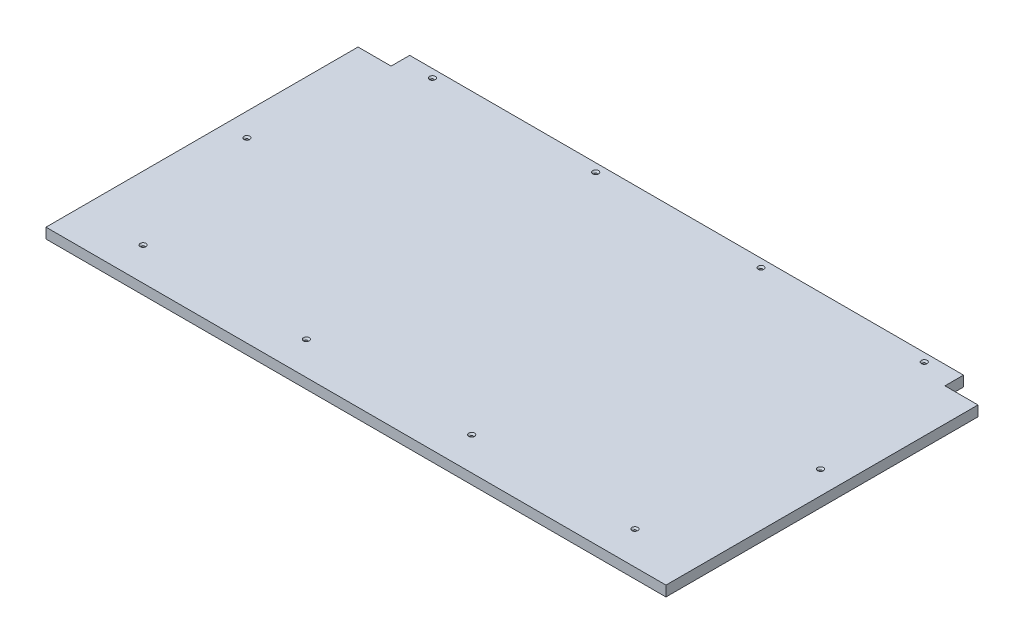
from build123d import *

# Parameters (mm, degrees)
SKETCH1_W                                 = 1500
SKETCH1_H                                 = 800
RAWMATERIAL_DEPTH                         = 25
SKETCH2_W                                 = 80
SKETCH2_H                                 = 45
SLOTSFORFRAME_DEPTH                       = 851.367567585
M6_CLEARANCE_HOLE_FRAME_MOUNT_D           = 6.6
M6_CLEARANCE_HOLE_FRAME_MOUNT_CSINK_D     = 14
M6_CLEARANCE_HOLE_FRAME_MOUNT_CSINK_ANGLE = 90


with BuildPart() as part:
    # Sketch1 → RawMaterial (new body)
    with BuildSketch(Plane(origin=(0, 0, 0), x_dir=(1, 0, 0), z_dir=(0, 1, 0))):
        Rectangle(SKETCH1_W, SKETCH1_H)
    extrude(amount=RAWMATERIAL_DEPTH)

    # Sketch2 → SlotsForFrame (cut, through all)
    with BuildSketch(Plane(origin=(0, 25, 0), x_dir=(1, 0, 0), z_dir=(0, 1, 0))):
        with Locations((710, 377.5)):
            Rectangle(SKETCH2_W, SKETCH2_H)
        with Locations((-710, 377.5)):
            Rectangle(SKETCH2_W, SKETCH2_H)
    extrude(amount=-SLOTSFORFRAME_DEPTH, mode=Mode.SUBTRACT)

    # M6 Clearance Hole frame mount (through all)
    with Locations(Plane(origin=(0, 25, 0), x_dir=(-1, 0, 0), z_dir=(0, 1, 0))):
        with Locations((-595, 320), (-200, 320), (200, 320), (595, 320), (694, -30), (-694, -30), (-595, -380), (-200, -380), (200, -380), (595, -380)):
            CounterSinkHole(M6_CLEARANCE_HOLE_FRAME_MOUNT_D / 2, M6_CLEARANCE_HOLE_FRAME_MOUNT_CSINK_D / 2, counter_sink_angle=M6_CLEARANCE_HOLE_FRAME_MOUNT_CSINK_ANGLE)


solid = part.part
